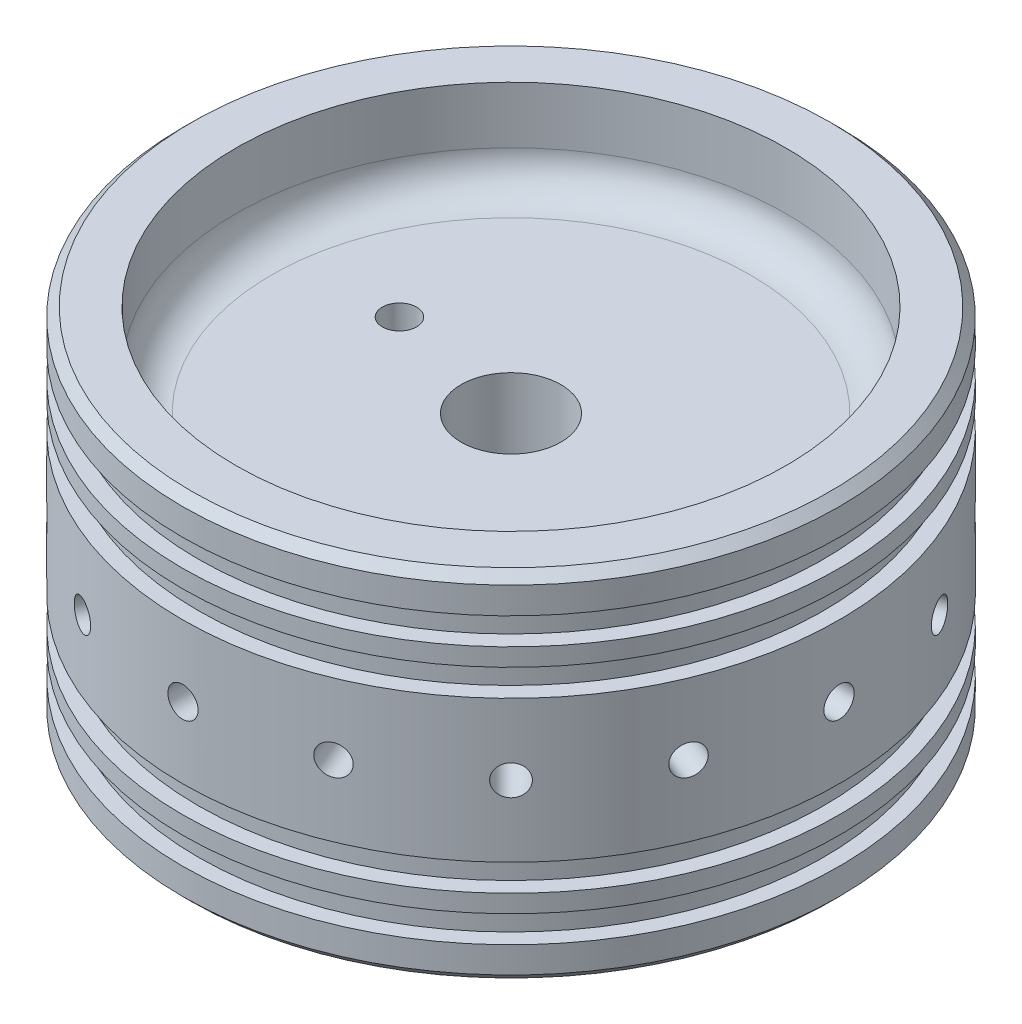
from build123d import *

# Parameters (mm, degrees)
HOLEPATTERN_COUNT              = 16
CHAMFER2_SIZE                  = 1.5875
FILLET1_R                      = 6.35
PIPE_TAP_DRILL_FOR_1_2_TAP1_D  = 17.8562
PIPE_TAP_DRILL_FOR_1_16_TAP1_D = 6.1468


with BuildPart() as part:
    # Sketch1 → Revolve1 (revolve)
    with BuildSketch(Plane.XY):
        Polygon((0, -15.24), (0, 15.3162), (-49.2125, 15.3162), (-49.2125, 31.8262), (-58.7375, 31.8262), (-58.7375, 25.4762), (-55.9181, 25.4762), (-55.9181, 20.6756), (-58.7375, 20.6756), (-58.7375, 17.5006), (-55.9181, 17.5006), (-55.9181, 12.7), (-58.7375, 12.7), (-58.7375, -12.7), (-55.9435, -12.7), (-55.9435, -17.5006), (-58.7375, -17.5006), (-58.7375, -20.6756), (-55.9435, -20.6756), (-55.9435, -25.4762), (-58.7375, -25.4762), (-58.7375, -31.75), (-49.2125, -31.75), (-49.2125, -15.24), align=None)
    revolve(axis=Axis((0, 31.75, 0), (0, -1, 0)))

    # Sketch4 → Tap Drill for 1/4-28 Tap1 (revolve, cut)
    with BuildSketch(Plane(origin=(0, 0, 58.7375), x_dir=(0, -1, 0), z_dir=(1, 0, 0))):
        Polygon((0, 0), (0, 20.675388061), (2.7051, 19.05), (2.7051, 0), align=None)
    tap_drill_for_1_4_28_tap1 = revolve(axis=Axis((0, 0, 65.0875), (0, 0, -1)), mode=Mode.SUBTRACT)

    # HolePattern: Tap Drill for 1/4-28 Tap1 ×16 about axis
    holepattern_axis = Axis((0, -12.7, 0), (0, 1, 0))
    for i in range(1, HOLEPATTERN_COUNT):
        add(tap_drill_for_1_4_28_tap1.rotate(holepattern_axis, i * 360 / HOLEPATTERN_COUNT), mode=Mode.SUBTRACT)

    # Chamfer2
    chamfer2_edges = [part.edges().sort_by_distance(p)[0] for p in [
        (58.7375, 31.8262, 0),
        (58.7375, -31.75, 0),
    ]]
    chamfer(chamfer2_edges, length=CHAMFER2_SIZE)

    # Fillet1
    fillet1_edges = [part.edges().sort_by_distance(p)[0] for p in [
        (49.2125, 15.3162, 0),
        (49.2125, -15.24, 0),
    ]]
    fillet(fillet1_edges, radius=FILLET1_R)

    # Pipe Tap Drill for 1/2 Tap1 (through all)
    with Locations(Plane(origin=(0, 15.3162, 0), x_dir=(1, 0, 0), z_dir=(0, 1, 0))):
        with Locations((0, 0)):
            Hole(PIPE_TAP_DRILL_FOR_1_2_TAP1_D / 2)

    # Pipe Tap Drill for 1/16 Tap1 (through all)
    with Locations(Plane(origin=(0, 15.3162, 0), x_dir=(1, 0, 0), z_dir=(0, 1, 0))):
        with Locations((-24.911946122, 4.955294179)):
            Hole(PIPE_TAP_DRILL_FOR_1_16_TAP1_D / 2)


solid = part.part
